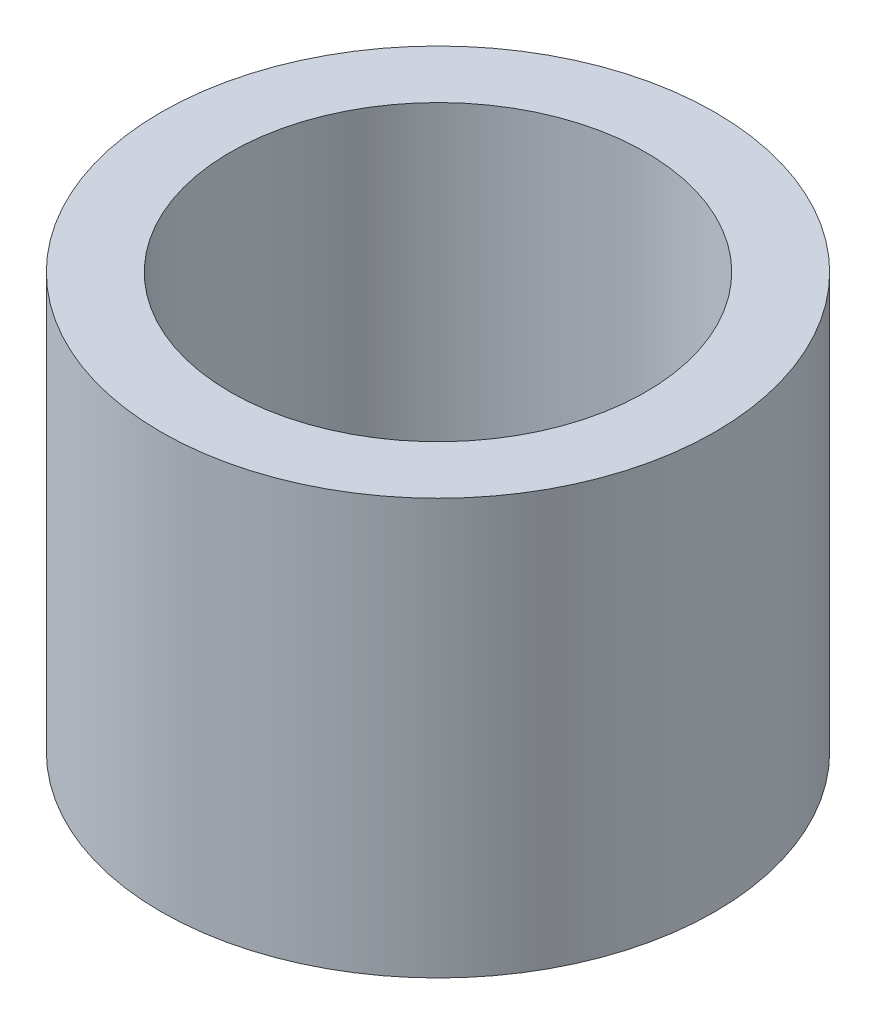
from build123d import *

# Parameters (mm, degrees)
SKETCH1_R           = 4
SKETCH1_R_2         = 3
BOSS_EXTRUDE1_DEPTH = 6


with BuildPart() as part:
    # Sketch1 → Boss-Extrude1 (new body)
    with BuildSketch(Plane(origin=(0, 0, 0), x_dir=(1, 0, 0), z_dir=(0, 1, 0))):
        Circle(SKETCH1_R)
        Circle(SKETCH1_R_2, mode=Mode.SUBTRACT)
    extrude(amount=BOSS_EXTRUDE1_DEPTH)


solid = part.part
